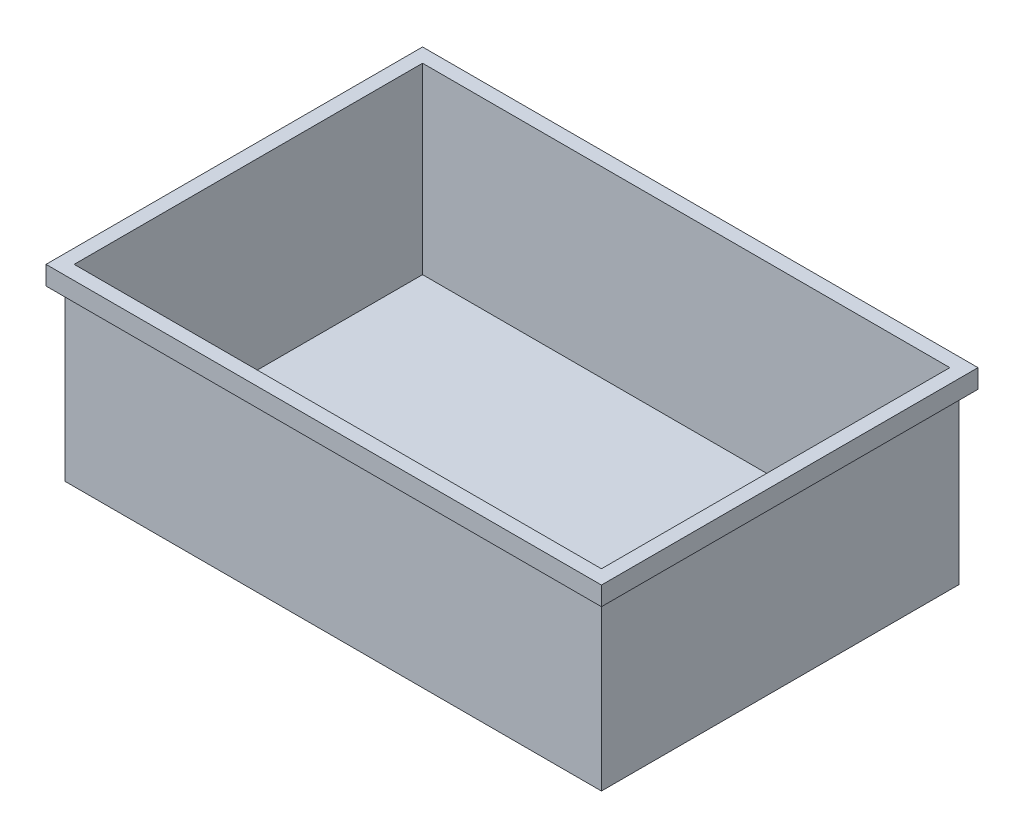
from build123d import *

# Parameters (mm, degrees)
SKETCH1_W           = 228.6
SKETCH1_H           = 152.4
BOSS_EXTRUDE1_DEPTH = 80
SHELL1_T            = -2
SKETCH2_W           = 236.6
SKETCH2_H           = 160.4
SKETCH2_W_2         = 224.6
SKETCH2_H_2         = 148.4
BOSS_EXTRUDE2_DEPTH = 10
CHAMFER1_SIZE       = 2


with BuildPart() as part:
    # Sketch1 → Boss-Extrude1 (new body)
    with BuildSketch(Plane(origin=(0, 0, 0), x_dir=(1, 0, 0), z_dir=(0, 1, 0))):
        with Locations((114.3, 76.2)):
            Rectangle(SKETCH1_W, SKETCH1_H)
    extrude(amount=BOSS_EXTRUDE1_DEPTH)

    # Shell1
    shell1_openings = [part.faces().sort_by_distance(p)[0] for p in [
        (114.3, 80, -76.2),
    ]]
    offset(amount=SHELL1_T, openings=shell1_openings, kind=Kind.INTERSECTION)

    # Sketch2 → Boss-Extrude2 (add)
    with BuildSketch(Plane(origin=(0, 80, 0), x_dir=(1, 0, 0), z_dir=(0, 1, 0))):
        with Locations((114.3, 76.2)):
            Rectangle(SKETCH2_W, SKETCH2_H)
        with Locations((114.3, 76.2)):
            Rectangle(SKETCH2_W_2, SKETCH2_H_2, mode=Mode.SUBTRACT)
    extrude(amount=-BOSS_EXTRUDE2_DEPTH)

    # Chamfer1
    chamfer1_edges = [part.edges().sort_by_distance(p)[0] for p in [
        (114.3, 70, -152.4),
        (0, 70, -76.2),
        (114.3, 70, 0),
        (228.6, 70, -76.2),
        (114.3, 70, 4),
        (-4, 70, -76.2),
        (114.3, 70, -156.4),
        (232.6, 70, -76.2),
    ]]
    chamfer(chamfer1_edges, length=CHAMFER1_SIZE - 0.0001)  # a hair under: the kernel refuses the full size


solid = part.part
